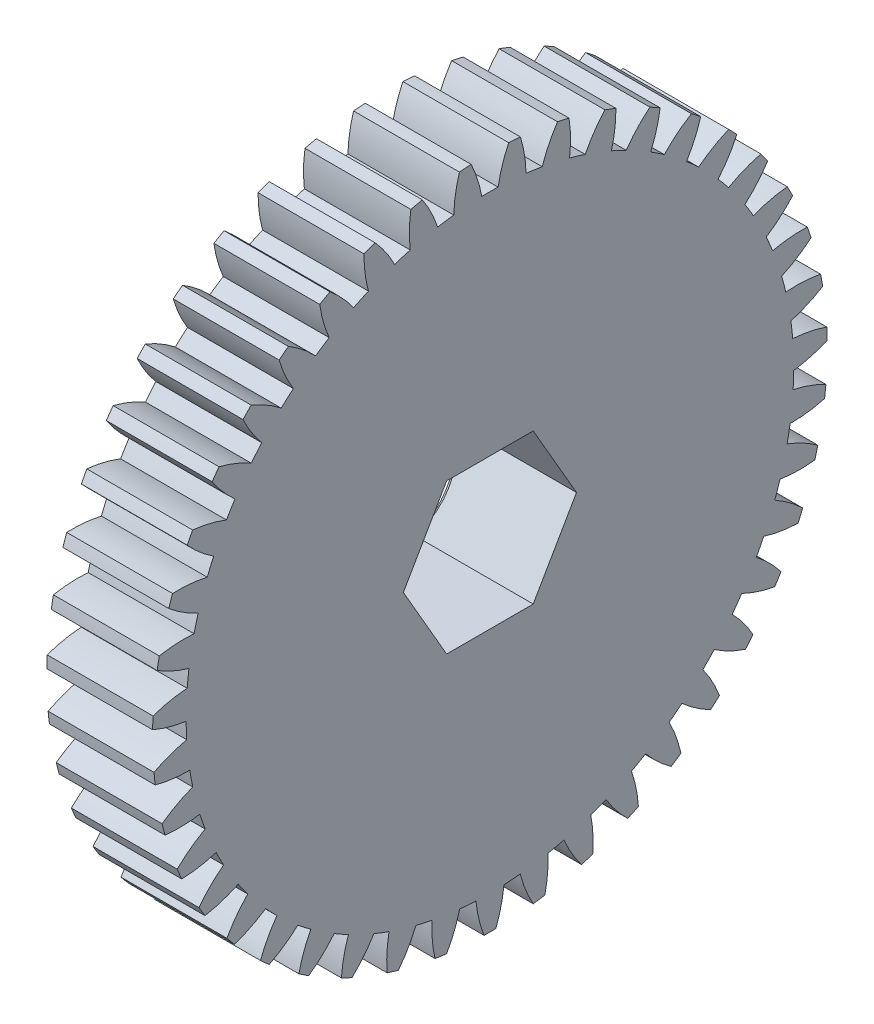
from build123d import *

# Parameters (mm, degrees)
BOSS_EXTRUDE1_START     = -0.508
BOSS_EXTRUDE1_OUTLINE_R = 28.575
BOSS_EXTRUDE1_DEPTH     = 9.474200466
CUT_EXTRUDE1_DEPTH      = 42.506887675
CUT_EXTRUDE2_DEPTH      = 42.506887675
CUT_EXTRUDE3_DEPTH      = 42.506887675
CUT_EXTRUDE4_DEPTH      = 42.506887675
CUT_EXTRUDE5_DEPTH      = 42.506887675
CUT_EXTRUDE6_DEPTH      = 42.506887675
CUT_EXTRUDE7_DEPTH      = 42.506887675
CUT_EXTRUDE8_DEPTH      = 42.506887675
CUT_EXTRUDE9_DEPTH      = 42.506887675
CUT_EXTRUDE10_DEPTH     = 42.506887675
CUT_EXTRUDE11_DEPTH     = 42.506887675
CUT_EXTRUDE12_DEPTH     = 42.506887675
CUT_EXTRUDE13_DEPTH     = 42.506887675
CUT_EXTRUDE14_DEPTH     = 42.506887675
CUT_EXTRUDE15_DEPTH     = 42.506887675
CUT_EXTRUDE16_DEPTH     = 42.506887675
CUT_EXTRUDE17_DEPTH     = 42.506887675
CUT_EXTRUDE18_DEPTH     = 42.506887675
CUT_EXTRUDE19_DEPTH     = 42.506887675
CUT_EXTRUDE20_DEPTH     = 42.506887675
CUT_EXTRUDE21_DEPTH     = 42.506887675
CUT_EXTRUDE22_DEPTH     = 42.506887675
CUT_EXTRUDE23_DEPTH     = 42.506887675
CUT_EXTRUDE24_DEPTH     = 42.506887675
CUT_EXTRUDE25_DEPTH     = 42.506887675
CUT_EXTRUDE26_DEPTH     = 42.506887675
CUT_EXTRUDE27_DEPTH     = 42.506887675
CUT_EXTRUDE28_DEPTH     = 42.506887675
CUT_EXTRUDE29_DEPTH     = 42.506887675
CUT_EXTRUDE30_DEPTH     = 42.506887675
CUT_EXTRUDE31_DEPTH     = 42.506887675
CUT_EXTRUDE32_DEPTH     = 42.503291927
CUT_EXTRUDE33_DEPTH     = 42.503291927
CUT_EXTRUDE34_DEPTH     = 42.503291927
CUT_EXTRUDE35_DEPTH     = 42.503291927
CUT_EXTRUDE36_DEPTH     = 42.503291927
CUT_EXTRUDE37_DEPTH     = 42.503291927
CUT_EXTRUDE38_DEPTH     = 42.503291927
CUT_EXTRUDE39_DEPTH     = 42.503291927
CUT_EXTRUDE40_DEPTH     = 42.503291927
CUT_EXTRUDE41_DEPTH     = 42.503291927
CUT_EXTRUDE42_DEPTH     = 42.503291927
CUT_EXTRUDE43_DEPTH     = 42.503291927


with BuildPart() as part:
    # Boss-Extrude1: read off the stored shape, not the designer's step
    # Boss-Extrude1 outline → Boss-Extrude1 (new body)
    with BuildSketch(Plane(origin=(0, 0, 0), x_dir=(0, 0, -1), z_dir=(1, 0, 0)).offset(BOSS_EXTRUDE1_START)):
        Circle(BOSS_EXTRUDE1_OUTLINE_R)
        Polygon((-3.666174209, 6.35), (3.666174209, 6.35), (7.332348419, 0), (3.666174209, -6.35), (-3.666174209, -6.35), (-7.332348419, 0), align=None, mode=Mode.SUBTRACT)
    extrude(amount=BOSS_EXTRUDE1_DEPTH)

    # Boss-Extrude1 2 outline → Boss-Extrude1 2 (revolve, cut)
    with BuildSketch(Plane.YX):
        Polygon((9.525, 0), (9.017, -0.508), (28.575, -0.508), (28.575, 0), align=None)
        Polygon((6.35, -0.508), (6.858, -0.508), (6.35, 0), align=None)
    revolve(axis=Axis((0, 0, 0), (1, 0, 0)), mode=Mode.SUBTRACT)

    # Sketch2 → Cut-Extrude1 (cut, through all)
    with BuildSketch(Plane(origin=(8.966200466, 0, 0), x_dir=(0, 0, -1), z_dir=(1, 0, 0))):
        with BuildLine():
            ThreePointArc((9.741695801, 26.863171591), (8.232431764, 27.363437142), (6.697678458, 27.778979972))
            ThreePointArc((6.697678458, 27.778979972), (6.823390693, 26.305881), (6.749002824, 24.82930029))
            ThreePointArc((6.749002824, 24.82930029), (7.412847446, 24.639254956), (8.071353298, 24.431464303))
            ThreePointArc((8.071353298, 24.431464303), (8.82404358, 25.703974219), (9.741695801, 26.863171591))
        make_face()
    extrude(amount=-CUT_EXTRUDE1_DEPTH, mode=Mode.SUBTRACT)

    # Sketch3 → Cut-Extrude2 (cut, through all)
    with BuildSketch(Plane(origin=(8.966200466, 0, 0), x_dir=(0, 0, -1), z_dir=(1, 0, 0))):
        with BuildLine():
            ThreePointArc((13.549191287, 25.158498375), (12.12885017, 25.873183386), (10.670955687, 26.507759802))
            ThreePointArc((10.670955687, 26.507759802), (10.580843322, 25.032055256), (10.292256302, 23.582040884))
            ThreePointArc((10.292256302, 23.582040884), (10.921355753, 23.29736424), (11.542589588, 22.995908715))
            ThreePointArc((11.542589588, 22.995908715), (12.472537657, 24.145265377), (13.549191287, 25.158498375))
        make_face()
    extrude(amount=-CUT_EXTRUDE2_DEPTH, mode=Mode.SUBTRACT)

    # Sketch4 → Cut-Extrude3 (cut, through all)
    with BuildSketch(Plane(origin=(8.966200466, 0, 0), x_dir=(0, 0, -1), z_dir=(1, 0, 0))):
        with BuildLine():
            ThreePointArc((17.067909284, 22.917615445), (15.766763193, 23.831487646), (14.416800021, 24.671572754))
            ThreePointArc((14.416800021, 24.671572754), (14.112783645, 23.224714713), (13.616148205, 21.832171218))
            ThreePointArc((13.616148205, 21.832171218), (14.197094324, 21.458930654), (14.767815622, 21.070235257))
            ThreePointArc((14.767815622, 21.070235257), (15.855201248, 22.071942124), (17.067909284, 22.917615445))
        make_face()
    extrude(amount=-CUT_EXTRUDE3_DEPTH, mode=Mode.SUBTRACT)

    # Sketch5 → Cut-Extrude4 (cut, through all)
    with BuildSketch(Plane(origin=(8.966200466, 0, 0), x_dir=(0, 0, -1), z_dir=(1, 0, 0))):
        with BuildLine():
            ThreePointArc((20.222854428, 20.18828333), (19.068635031, 21.281865122), (17.855375292, 22.309553966))
            ThreePointArc((17.855375292, 22.309553966), (17.343934487, 20.922379698), (16.649835549, 19.616986727))
            ThreePointArc((16.649835549, 19.616986727), (17.170246477, 19.163137216), (17.678291304, 18.695486316))
            ThreePointArc((17.678291304, 18.695486316), (18.899938752, 19.528193745), (20.222854428, 20.18828333))
        make_face()
    extrude(amount=-CUT_EXTRUDE4_DEPTH, mode=Mode.SUBTRACT)

    # Sketch6 → Cut-Extrude5 (cut, through all)
    with BuildSketch(Plane(origin=(8.966200466, 0, 0), x_dir=(0, 0, -1), z_dir=(1, 0, 0))):
        with BuildLine():
            ThreePointArc((22.946784539, 17.028673005), (21.964092019, 18.278656591), (20.913394239, 19.472045768))
            ThreePointArc((20.913394239, 19.472045768), (20.205429477, 18.174120484), (19.328660555, 16.983700221))
            ThreePointArc((19.328660555, 16.983700221), (19.777444636, 16.458914779), (20.2119849, 15.922275542))
            ThreePointArc((20.2119849, 15.922275542), (21.541856874, 16.568235819), (22.946784539, 17.028673005))
        make_face()
    extrude(amount=-CUT_EXTRUDE5_DEPTH, mode=Mode.SUBTRACT)

    # Sketch7 → Cut-Extrude6 (cut, through all)
    with BuildSketch(Plane(origin=(8.966200466, 0, 0), x_dir=(0, 0, -1), z_dir=(1, 0, 0))):
        with BuildLine():
            ThreePointArc((25.181643777, 13.50612608), (24.391422519, 14.885870229), (23.525680496, 16.219524721))
            ThreePointArc((23.525680496, 16.219524721), (22.636280817, 15.038511445), (21.595528718, 13.988435632))
            ThreePointArc((21.595528718, 13.988435632), (21.9631209, 13.403899149), (22.314895128, 12.809709109))
            ThreePointArc((22.314895128, 12.809709109), (23.724647717, 13.255154713), (25.181643777, 13.50612608))
        make_face()
    extrude(amount=-CUT_EXTRUDE6_DEPTH, mode=Mode.SUBTRACT)

    # Sketch8 → Cut-Extrude7 (cut, through all)
    with BuildSketch(Plane(origin=(8.966200466, 0, 0), x_dir=(0, 0, -1), z_dir=(1, 0, 0))):
        with BuildLine():
            ThreePointArc((26.879799997, 9.695719527), (26.298892195, 11.175817388), (25.636557718, 12.621312664))
            ThreePointArc((25.636557718, 12.621312664), (24.584679132, 11.582382644), (23.40212568, 10.695031823))
            ThreePointArc((23.40212568, 10.695031823), (23.680691372, 10.063202679), (23.942202109, 9.424125965))
            ThreePointArc((23.942202109, 9.424125965), (25.401788883, 9.659562996), (26.879799997, 9.695719527))
        make_face()
    extrude(amount=-CUT_EXTRUDE7_DEPTH, mode=Mode.SUBTRACT)

    # Sketch9 → Cut-Extrude8 (cut, through all)
    with BuildSketch(Plane(origin=(8.966200466, 0, 0), x_dir=(0, 0, -1), z_dir=(1, 0, 0))):
        with BuildLine():
            ThreePointArc((28.005059947, 5.678665544), (27.645846643, 7.227571402), (27.201036221, 8.75409924))
            ThreePointArc((27.201036221, 8.75409924), (26.009097694, 7.879395465), (24.709946963, 7.173681979))
            ThreePointArc((24.709946963, 7.173681979), (24.893549022, 6.508026516), (25.059222619, 5.837683939))
            ThreePointArc((25.059222619, 5.837683939), (26.537535021, 5.858094465), (28.005059947, 5.678665544))
        make_face()
    extrude(amount=-CUT_EXTRUDE8_DEPTH, mode=Mode.SUBTRACT)

    # Sketch10 → Cut-Extrude9 (cut, through all)
    with BuildSketch(Plane(origin=(8.966200466, 0, 0), x_dir=(0, 0, -1), z_dir=(1, 0, 0))):
        with BuildLine():
            ThreePointArc((28.533440666, 1.540580665), (28.403577867, 3.125282279), (28.185771862, 4.700307389))
            ThreePointArc((28.185771862, 4.700307389), (26.879177494, 4.008472652), (25.491118626, 3.499437558))
            ThreePointArc((25.491118626, 3.499437558), (25.575843893, 2.814143066), (25.642149306, 2.126821814))
            ThreePointArc((25.642149306, 2.126821814), (27.107679673, 1.93177082), (28.533440666, 1.540580665))
        make_face()
    extrude(amount=-CUT_EXTRUDE9_DEPTH, mode=Mode.SUBTRACT)

    # Sketch11 → Cut-Extrude10 (cut, through all)
    with BuildSketch(Plane(origin=(8.966200466, 0, 0), x_dir=(0, 0, -1), z_dir=(1, 0, 0))):
        with BuildLine():
            ThreePointArc((28.453680635, -2.630339017), (28.555936142, -1.043616809), (28.56977671, 0.546336647))
            ThreePointArc((28.56977671, 0.546336647), (27.176374292, 0.052116204), (25.728991353, -0.249391299))
            ThreePointArc((25.728991353, -0.249391299), (25.713034055, -0.939718958), (25.678558098, -1.629369826))
            ThreePointArc((25.678558098, -1.629369826), (27.100071195, -2.035725165), (28.453680635, -2.630339017))
        make_face()
    extrude(amount=-CUT_EXTRUDE10_DEPTH, mode=Mode.SUBTRACT)

    # Sketch12 → Cut-Extrude11 (cut, through all)
    with BuildSketch(Plane(origin=(8.966200466, 0, 0), x_dir=(0, 0, -1), z_dir=(1, 0, 0))):
        with BuildLine():
            ThreePointArc((27.767479801, -6.745197589), (28.099674215, -5.190273017), (28.344866369, -3.619278313))
            ThreePointArc((28.344866369, -3.619278313), (26.894353854, -3.905351011), (25.418495298, -3.992904813))
            ThreePointArc((25.418495298, -3.992904813), (25.302195538, -4.673552503), (25.167673007, -5.350834276))
            ThreePointArc((25.167673007, -5.350834276), (26.51487175, -5.959833203), (27.767479801, -6.745197589))
        make_face()
    extrude(amount=-CUT_EXTRUDE11_DEPTH, mode=Mode.SUBTRACT)

    # Sketch13 → Cut-Extrude12 (cut, through all)
    with BuildSketch(Plane(origin=(8.966200466, 0, 0), x_dir=(0, 0, -1), z_dir=(1, 0, 0))):
        with BuildLine():
            ThreePointArc((26.489463344, -10.716293985), (27.044516518, -9.226307566), (27.515834413, -7.707754638))
            ThreePointArc((27.515834413, -7.707754638), (26.039126956, -7.779582449), (24.566248146, -7.651316494))
            ThreePointArc((24.566248146, -7.651316494), (24.352084651, -8.307777391), (24.12038266, -8.958254984))
            ThreePointArc((24.12038266, -8.958254984), (25.364553847, -9.756917744), (26.489463344, -10.716293985))
        make_face()
    extrude(amount=-CUT_EXTRUDE12_DEPTH, mode=Mode.SUBTRACT)

    # Sketch14 → Cut-Extrude13 (cut, through all)
    with BuildSketch(Plane(origin=(8.966200466, 0, 0), x_dir=(0, 0, -1), z_dir=(1, 0, 0))):
        with BuildLine():
            ThreePointArc((24.646869965, -14.45899118), (25.412951904, -13.065699388), (26.100350217, -11.631953556))
            ThreePointArc((26.100350217, -11.631953556), (24.628921276, -11.488005594), (23.190414065, -11.146653647))
            ThreePointArc((23.190414065, -11.146653647), (22.882951359, -11.764936427), (22.559008234, -12.374746039))
            ThreePointArc((22.559008234, -12.374746039), (23.673634516, -13.346050522), (24.646869965, -14.45899118))
        make_face()
    extrude(amount=-CUT_EXTRUDE13_DEPTH, mode=Mode.SUBTRACT)

    # Sketch15 → Cut-Extrude14 (cut, through all)
    with BuildSketch(Plane(origin=(8.966200466, 0, 0), x_dir=(0, 0, -1), z_dir=(1, 0, 0))):
        with BuildLine():
            ThreePointArc((22.278971344, -17.89352008), (23.239754342, -16.626618512), (24.128582371, -15.308237578))
            ThreePointArc((24.128582371, -15.308237578), (22.693792897, -14.951581845), (21.320316571, -14.40441923))
            ThreePointArc((21.320316571, -14.40441923), (20.926107687, -14.971346269), (20.516827713, -15.527490867))
            ThreePointArc((20.516827713, -15.527490867), (21.478152766, -16.650735404), (22.278971344, -17.89352008))
        make_face()
    extrude(amount=-CUT_EXTRUDE14_DEPTH, mode=Mode.SUBTRACT)

    # Sketch16 → Cut-Extrude15 (cut, through all)
    with BuildSketch(Plane(origin=(8.966200466, 0, 0), x_dir=(0, 0, -1), z_dir=(1, 0, 0))):
        with BuildLine():
            ThreePointArc((19.436235128, -20.946679667), (20.571241763, -19.833170128), (21.642555683, -18.658253094))
            ThreePointArc((21.642555683, -18.658253094), (20.274985723, -18.096491087), (18.995813544, -17.355179626))
            ThreePointArc((18.995813544, -17.355179626), (18.52326036, -17.858667858), (18.037366629, -18.349294186))
            ThreePointArc((18.037366629, -18.349294186), (18.824901479, -19.600538769), (19.436235128, -20.946679667))
        make_face()
    extrude(amount=-CUT_EXTRUDE15_DEPTH, mode=Mode.SUBTRACT)

    # Sketch17 → Cut-Extrude16 (cut, through all)
    with BuildSketch(Plane(origin=(8.966200466, 0, 0), x_dir=(0, 0, -1), z_dir=(1, 0, 0))):
        with BuildLine():
            ThreePointArc((16.179249304, -23.553397142), (17.46428888, -22.617012157), (18.695255495, -21.610600339))
            ThreePointArc((18.695255495, -21.610600339), (17.424052429, -20.855705039), (16.266447731, -19.936044498))
            ThreePointArc((16.266447731, -19.936044498), (15.725621898, -20.365362947), (15.173470392, -20.780014156))
            ThreePointArc((15.173470392, -20.780014156), (15.7704301, -22.13259068), (16.179249304, -23.553397142))
        make_face()
    extrude(amount=-CUT_EXTRUDE16_DEPTH, mode=Mode.SUBTRACT)

    # Sketch18 → Cut-Extrude17 (cut, through all)
    with BuildSketch(Plane(origin=(8.966200466, 0, 0), x_dir=(0, 0, -1), z_dir=(1, 0, 0))):
        with BuildLine():
            ThreePointArc((12.577430872, -25.65811485), (13.985115001, -24.918811838), (15.349498393, -24.102355156))
            ThreePointArc((15.349498393, -24.102355156), (14.201755708, -23.170415848), (13.190390826, -22.092007195))
            ThreePointArc((13.190390826, -22.092007195), (12.592819108, -22.438005681), (11.986177976, -22.767844201))
            ThreePointArc((11.986177976, -22.767844201), (12.379839383, -24.192924845), (12.577430872, -25.65811485))
        make_face()
    extrude(amount=-CUT_EXTRUDE17_DEPTH, mode=Mode.SUBTRACT)

    # Sketch19 → Cut-Extrude18 (cut, through all)
    with BuildSketch(Plane(origin=(8.966200466, 0, 0), x_dir=(0, 0, -1), z_dir=(1, 0, 0))):
        with BuildLine():
            ThreePointArc((8.707546336, -27.215974386), (10.207872676, -26.689510307), (11.676593383, -26.080410119))
            ThreePointArc((11.676593383, -26.080410119), (10.67677322, -24.991289469), (9.833203641, -23.777117113))
            ThreePointArc((9.833203641, -23.777117113), (9.191622241, -24.032421281), (8.543420987, -24.270417176))
            ThreePointArc((8.543420987, -24.270417176), (8.725393883, -25.737628821), (8.707546336, -27.215974386))
        make_face()
    extrude(amount=-CUT_EXTRUDE18_DEPTH, mode=Mode.SUBTRACT)

    # Sketch20 → Cut-Extrude19 (cut, through all)
    with BuildSketch(Plane(origin=(8.966200466, 0, 0), x_dir=(0, 0, -1), z_dir=(1, 0, 0))):
        with BuildLine():
            ThreePointArc((4.652075568, -28.19377268), (6.213067267, -27.891368201), (7.754822057, -27.50260642))
            ThreePointArc((7.754822057, -27.50260642), (6.924233848, -26.279517145), (6.266438792, -24.95545906))
            ThreePointArc((6.266438792, -24.95545906), (5.594521904, -25.114627545), (4.918575812, -25.255708345))
            ThreePointArc((4.918575812, -25.255708345), (4.884981761, -26.733779922), (4.652075568, -28.19377268))
        make_face()
    extrude(amount=-CUT_EXTRUDE19_DEPTH, mode=Mode.SUBTRACT)

    # Sketch21 → Cut-Extrude20 (cut, through all)
    with BuildSketch(Plane(origin=(8.966200466, 0, 0), x_dir=(0, 0, -1), z_dir=(1, 0, 0))):
        with BuildLine():
            ThreePointArc((0.497453886, -28.570669657), (2.085841116, -28.498770006), (3.667770162, -28.338632413))
            ThreePointArc((3.667770162, -28.338632413), (3.024116453, -27.007642537), (2.56611568, -25.601918724))
            ThreePointArc((2.56611568, -25.601918724), (1.878184045, -25.661559125), (1.188899733, -25.702717939))
            ThreePointArc((1.188899733, -25.702717939), (0.940454734, -27.160146918), (0.497453886, -28.570669657))
        make_face()
    extrude(amount=-CUT_EXTRUDE20_DEPTH, mode=Mode.SUBTRACT)

    # Sketch22 → Cut-Extrude21 (cut, through all)
    with BuildSketch(Plane(origin=(8.966200466, 0, 0), x_dir=(0, 0, -1), z_dir=(1, 0, 0))):
        with BuildLine():
            ThreePointArc((-3.667770162, -28.338632413), (-2.085841116, -28.498770006), (-0.497453886, -28.570669657))
            ThreePointArc((-0.497453886, -28.570669657), (-0.940454734, -27.160146918), (-1.188899733, -25.702717939))
            ThreePointArc((-1.188899733, -25.702717939), (-1.878184045, -25.661559125), (-2.56611568, -25.601918724))
            ThreePointArc((-2.56611568, -25.601918724), (-3.024116453, -27.007642537), (-3.667770162, -28.338632413))
        make_face()
    extrude(amount=-CUT_EXTRUDE21_DEPTH, mode=Mode.SUBTRACT)

    # Sketch23 → Cut-Extrude22 (cut, through all)
    with BuildSketch(Plane(origin=(8.966200466, 0, 0), x_dir=(0, 0, -1), z_dir=(1, 0, 0))):
        with BuildLine():
            ThreePointArc((-7.754822057, -27.50260642), (-6.213067267, -27.891368201), (-4.652075568, -28.19377268))
            ThreePointArc((-4.652075568, -28.19377268), (-4.884981761, -26.733779922), (-4.918575812, -25.255708345))
            ThreePointArc((-4.918575812, -25.255708345), (-5.594521904, -25.114627545), (-6.266438792, -24.95545906))
            ThreePointArc((-6.266438792, -24.95545906), (-6.924233848, -26.279517145), (-7.754822057, -27.50260642))
        make_face()
    extrude(amount=-CUT_EXTRUDE22_DEPTH, mode=Mode.SUBTRACT)

    # Sketch24 → Cut-Extrude23 (cut, through all)
    with BuildSketch(Plane(origin=(8.966200466, 0, 0), x_dir=(0, 0, -1), z_dir=(1, 0, 0))):
        with BuildLine():
            ThreePointArc((-11.676593383, -26.080410119), (-10.207872676, -26.689510307), (-8.707546336, -27.215974386))
            ThreePointArc((-8.707546336, -27.215974386), (-8.725393883, -25.737628821), (-8.543420987, -24.270417176))
            ThreePointArc((-8.543420987, -24.270417176), (-9.191622241, -24.032421281), (-9.833203641, -23.777117113))
            ThreePointArc((-9.833203641, -23.777117113), (-10.67677322, -24.991289469), (-11.676593383, -26.080410119))
        make_face()
    extrude(amount=-CUT_EXTRUDE23_DEPTH, mode=Mode.SUBTRACT)

    # Sketch25 → Cut-Extrude24 (cut, through all)
    with BuildSketch(Plane(origin=(8.966200466, 0, 0), x_dir=(0, 0, -1), z_dir=(1, 0, 0))):
        with BuildLine():
            ThreePointArc((-15.349498393, -24.102355156), (-13.985115001, -24.918811838), (-12.577430872, -25.65811485))
            ThreePointArc((-12.577430872, -25.65811485), (-12.379839383, -24.192924845), (-11.986177976, -22.767844201))
            ThreePointArc((-11.986177976, -22.767844201), (-12.592819108, -22.438005681), (-13.190390826, -22.092007195))
            ThreePointArc((-13.190390826, -22.092007195), (-14.201755708, -23.170415848), (-15.349498393, -24.102355156))
        make_face()
    extrude(amount=-CUT_EXTRUDE24_DEPTH, mode=Mode.SUBTRACT)

    # Sketch26 → Cut-Extrude25 (cut, through all)
    with BuildSketch(Plane(origin=(8.966200466, 0, 0), x_dir=(0, 0, -1), z_dir=(1, 0, 0))):
        with BuildLine():
            ThreePointArc((-18.695255495, -21.610600339), (-17.46428888, -22.617012157), (-16.179249304, -23.553397142))
            ThreePointArc((-16.179249304, -23.553397142), (-15.7704301, -22.13259068), (-15.173470392, -20.780014156))
            ThreePointArc((-15.173470392, -20.780014156), (-15.725621898, -20.365362947), (-16.266447731, -19.936044498))
            ThreePointArc((-16.266447731, -19.936044498), (-17.424052429, -20.855705039), (-18.695255495, -21.610600339))
        make_face()
    extrude(amount=-CUT_EXTRUDE25_DEPTH, mode=Mode.SUBTRACT)

    # Sketch27 → Cut-Extrude26 (cut, through all)
    with BuildSketch(Plane(origin=(8.966200466, 0, 0), x_dir=(0, 0, -1), z_dir=(1, 0, 0))):
        with BuildLine():
            ThreePointArc((-21.642555683, -18.658253094), (-20.571241763, -19.833170128), (-19.436235128, -20.946679667))
            ThreePointArc((-19.436235128, -20.946679667), (-18.824901479, -19.600538769), (-18.037366629, -18.349294186))
            ThreePointArc((-18.037366629, -18.349294186), (-18.52326036, -17.858667858), (-18.995813544, -17.355179626))
            ThreePointArc((-18.995813544, -17.355179626), (-20.274985723, -18.096491087), (-21.642555683, -18.658253094))
        make_face()
    extrude(amount=-CUT_EXTRUDE26_DEPTH, mode=Mode.SUBTRACT)

    # Sketch28 → Cut-Extrude27 (cut, through all)
    with BuildSketch(Plane(origin=(8.966200466, 0, 0), x_dir=(0, 0, -1), z_dir=(1, 0, 0))):
        with BuildLine():
            ThreePointArc((-24.128582371, -15.308237578), (-23.239754342, -16.626618512), (-22.278971344, -17.89352008))
            ThreePointArc((-22.278971344, -17.89352008), (-21.478152766, -16.650735404), (-20.516827713, -15.527490867))
            ThreePointArc((-20.516827713, -15.527490867), (-20.926107687, -14.971346269), (-21.320316571, -14.40441923))
            ThreePointArc((-21.320316571, -14.40441923), (-22.693792897, -14.951581845), (-24.128582371, -15.308237578))
        make_face()
    extrude(amount=-CUT_EXTRUDE27_DEPTH, mode=Mode.SUBTRACT)

    # Sketch29 → Cut-Extrude28 (cut, through all)
    with BuildSketch(Plane(origin=(8.966200466, 0, 0), x_dir=(0, 0, -1), z_dir=(1, 0, 0))):
        with BuildLine():
            ThreePointArc((-26.100350217, -11.631953556), (-25.412951904, -13.065699388), (-24.646869965, -14.45899118))
            ThreePointArc((-24.646869965, -14.45899118), (-23.673634516, -13.346050522), (-22.559008234, -12.374746039))
            ThreePointArc((-22.559008234, -12.374746039), (-22.882951359, -11.764936427), (-23.190414065, -11.146653647))
            ThreePointArc((-23.190414065, -11.146653647), (-24.628921276, -11.488005594), (-26.100350217, -11.631953556))
        make_face()
    extrude(amount=-CUT_EXTRUDE28_DEPTH, mode=Mode.SUBTRACT)

    # Sketch30 → Cut-Extrude29 (cut, through all)
    with BuildSketch(Plane(origin=(8.966200466, 0, 0), x_dir=(0, 0, -1), z_dir=(1, 0, 0))):
        with BuildLine():
            ThreePointArc((-27.515834413, -7.707754638), (-27.044516518, -9.226307566), (-26.489463344, -10.716293985))
            ThreePointArc((-26.489463344, -10.716293985), (-25.364553847, -9.756917744), (-24.12038266, -8.958254984))
            ThreePointArc((-24.12038266, -8.958254984), (-24.352084651, -8.307777391), (-24.566248146, -7.651316494))
            ThreePointArc((-24.566248146, -7.651316494), (-26.039126956, -7.779582449), (-27.515834413, -7.707754638))
        make_face()
    extrude(amount=-CUT_EXTRUDE29_DEPTH, mode=Mode.SUBTRACT)

    # Sketch31 → Cut-Extrude30 (cut, through all)
    with BuildSketch(Plane(origin=(8.966200466, 0, 0), x_dir=(0, 0, -1), z_dir=(1, 0, 0))):
        with BuildLine():
            ThreePointArc((-28.344866369, -3.619278313), (-28.099674215, -5.190273017), (-27.767479801, -6.745197589))
            ThreePointArc((-27.767479801, -6.745197589), (-26.51487175, -5.959833203), (-25.167673007, -5.350834276))
            ThreePointArc((-25.167673007, -5.350834276), (-25.302195538, -4.673552503), (-25.418495298, -3.992904813))
            ThreePointArc((-25.418495298, -3.992904813), (-26.894353854, -3.905351011), (-28.344866369, -3.619278313))
        make_face()
    extrude(amount=-CUT_EXTRUDE30_DEPTH, mode=Mode.SUBTRACT)

    # Sketch32 → Cut-Extrude31 (cut, through all)
    with BuildSketch(Plane(origin=(8.966200466, 0, 0), x_dir=(0, 0, -1), z_dir=(1, 0, 0))):
        with BuildLine():
            ThreePointArc((-28.56977671, 0.546336647), (-28.555936142, -1.043616809), (-28.453680635, -2.630339017))
            ThreePointArc((-28.453680635, -2.630339017), (-27.100071195, -2.035725165), (-25.678558098, -1.629369826))
            ThreePointArc((-25.678558098, -1.629369826), (-25.713034055, -0.939718958), (-25.728991353, -0.249391299))
            ThreePointArc((-25.728991353, -0.249391299), (-27.176374292, 0.052116204), (-28.56977671, 0.546336647))
        make_face()
    extrude(amount=-CUT_EXTRUDE31_DEPTH, mode=Mode.SUBTRACT)

    # Sketch33 → Cut-Extrude32 (cut, through all)
    with BuildSketch(Plane(origin=(8.966200466, 0, 0), x_dir=(0, 0, -1), z_dir=(1, 0, 0))):
        with BuildLine():
            ThreePointArc((-28.185771862, 4.700307389), (-28.403577867, 3.125282279), (-28.533440666, 1.540580665))
            ThreePointArc((-28.533440666, 1.540580665), (-27.107679673, 1.93177082), (-25.642149306, 2.126821814))
            ThreePointArc((-25.642149306, 2.126821814), (-25.575843893, 2.814143066), (-25.491118626, 3.499437558))
            ThreePointArc((-25.491118626, 3.499437558), (-26.879177494, 4.008472652), (-28.185771862, 4.700307389))
        make_face()
    extrude(amount=-CUT_EXTRUDE32_DEPTH, mode=Mode.SUBTRACT)

    # Sketch34 → Cut-Extrude33 (cut, through all)
    with BuildSketch(Plane(origin=(8.966200466, 0, 0), x_dir=(0, 0, -1), z_dir=(1, 0, 0))):
        with BuildLine():
            ThreePointArc((-27.201036221, 8.75409924), (-27.645846643, 7.227571402), (-28.005059947, 5.678665544))
            ThreePointArc((-28.005059947, 5.678665544), (-26.537535021, 5.858094465), (-25.059222619, 5.837683939))
            ThreePointArc((-25.059222619, 5.837683939), (-24.893549022, 6.508026516), (-24.709946963, 7.173681979))
            ThreePointArc((-24.709946963, 7.173681979), (-26.009097694, 7.879395465), (-27.201036221, 8.75409924))
        make_face()
    extrude(amount=-CUT_EXTRUDE33_DEPTH, mode=Mode.SUBTRACT)

    # Sketch35 → Cut-Extrude34 (cut, through all)
    with BuildSketch(Plane(origin=(8.966200466, 0, 0), x_dir=(0, 0, -1), z_dir=(1, 0, 0))):
        with BuildLine():
            ThreePointArc((-25.636557718, 12.621312664), (-26.298892195, 11.175817388), (-26.879799997, 9.695719527))
            ThreePointArc((-26.879799997, 9.695719527), (-25.401788883, 9.659562996), (-23.942202109, 9.424125965))
            ThreePointArc((-23.942202109, 9.424125965), (-23.680691372, 10.063202679), (-23.40212568, 10.695031823))
            ThreePointArc((-23.40212568, 10.695031823), (-24.584679132, 11.582382644), (-25.636557718, 12.621312664))
        make_face()
    extrude(amount=-CUT_EXTRUDE34_DEPTH, mode=Mode.SUBTRACT)

    # Sketch36 → Cut-Extrude35 (cut, through all)
    with BuildSketch(Plane(origin=(8.966200466, 0, 0), x_dir=(0, 0, -1), z_dir=(1, 0, 0))):
        with BuildLine():
            ThreePointArc((-23.525680496, 16.219524721), (-24.391422519, 14.885870229), (-25.181643777, 13.50612608))
            ThreePointArc((-25.181643777, 13.50612608), (-23.724647717, 13.255154713), (-22.314895128, 12.809709109))
            ThreePointArc((-22.314895128, 12.809709109), (-21.9631209, 13.403899149), (-21.595528718, 13.988435632))
            ThreePointArc((-21.595528718, 13.988435632), (-22.636280817, 15.038511445), (-23.525680496, 16.219524721))
        make_face()
    extrude(amount=-CUT_EXTRUDE35_DEPTH, mode=Mode.SUBTRACT)

    # Sketch37 → Cut-Extrude36 (cut, through all)
    with BuildSketch(Plane(origin=(8.966200466, 0, 0), x_dir=(0, 0, -1), z_dir=(1, 0, 0))):
        with BuildLine():
            ThreePointArc((-20.913394239, 19.472045768), (-21.964092019, 18.278656591), (-22.946784539, 17.028673005))
            ThreePointArc((-22.946784539, 17.028673005), (-21.541856874, 16.568235819), (-20.2119849, 15.922275542))
            ThreePointArc((-20.2119849, 15.922275542), (-19.777444636, 16.458914779), (-19.328660555, 16.983700221))
            ThreePointArc((-19.328660555, 16.983700221), (-20.205429477, 18.174120484), (-20.913394239, 19.472045768))
        make_face()
    extrude(amount=-CUT_EXTRUDE36_DEPTH, mode=Mode.SUBTRACT)

    # Sketch38 → Cut-Extrude37 (cut, through all)
    with BuildSketch(Plane(origin=(8.966200466, 0, 0), x_dir=(0, 0, -1), z_dir=(1, 0, 0))):
        with BuildLine():
            ThreePointArc((-17.855375292, 22.309553966), (-19.068635031, 21.281865122), (-20.222854428, 20.18828333))
            ThreePointArc((-20.222854428, 20.18828333), (-18.899938752, 19.528193745), (-17.678291304, 18.695486316))
            ThreePointArc((-17.678291304, 18.695486316), (-17.170246477, 19.163137216), (-16.649835549, 19.616986727))
            ThreePointArc((-16.649835549, 19.616986727), (-17.343934487, 20.922379698), (-17.855375292, 22.309553966))
        make_face()
    extrude(amount=-CUT_EXTRUDE37_DEPTH, mode=Mode.SUBTRACT)

    # Sketch39 → Cut-Extrude38 (cut, through all)
    with BuildSketch(Plane(origin=(8.966200466, 0, 0), x_dir=(0, 0, -1), z_dir=(1, 0, 0))):
        with BuildLine():
            ThreePointArc((-14.416800021, 24.671572754), (-15.766763193, 23.831487646), (-17.067909284, 22.917615445))
            ThreePointArc((-17.067909284, 22.917615445), (-15.855201248, 22.071942124), (-14.767815622, 21.070235257))
            ThreePointArc((-14.767815622, 21.070235257), (-14.197094324, 21.458930654), (-13.616148205, 21.832171218))
            ThreePointArc((-13.616148205, 21.832171218), (-14.112783645, 23.224714713), (-14.416800021, 24.671572754))
        make_face()
    extrude(amount=-CUT_EXTRUDE38_DEPTH, mode=Mode.SUBTRACT)

    # Sketch40 → Cut-Extrude39 (cut, through all)
    with BuildSketch(Plane(origin=(8.966200466, 0, 0), x_dir=(0, 0, -1), z_dir=(1, 0, 0))):
        with BuildLine():
            ThreePointArc((-13.549191287, 25.158498375), (-12.472537657, 24.145265377), (-11.542589588, 22.995908715))
            ThreePointArc((-11.542589588, 22.995908715), (-10.921355753, 23.29736424), (-10.292256302, 23.582040884))
            ThreePointArc((-10.292256302, 23.582040884), (-10.580843322, 25.032055256), (-10.670955687, 26.507759802))
            ThreePointArc((-10.670955687, 26.507759802), (-12.12885017, 25.873183386), (-13.549191287, 25.158498375))
        make_face()
    extrude(amount=-CUT_EXTRUDE39_DEPTH, mode=Mode.SUBTRACT)

    # Sketch41 → Cut-Extrude40 (cut, through all)
    with BuildSketch(Plane(origin=(8.966200466, 0, 0), x_dir=(0, 0, -1), z_dir=(1, 0, 0))):
        with BuildLine():
            ThreePointArc((-6.697678458, 27.778979972), (-8.232431764, 27.363437142), (-9.741695801, 26.863171591))
            ThreePointArc((-9.741695801, 26.863171591), (-8.82404358, 25.703974219), (-8.071353298, 24.431464303))
            ThreePointArc((-8.071353298, 24.431464303), (-7.412847446, 24.639254956), (-6.749002824, 24.82930029))
            ThreePointArc((-6.749002824, 24.82930029), (-6.823390693, 26.305881), (-6.697678458, 27.778979972))
        make_face()
    extrude(amount=-CUT_EXTRUDE40_DEPTH, mode=Mode.SUBTRACT)

    # Sketch42 → Cut-Extrude41 (cut, through all)
    with BuildSketch(Plane(origin=(8.966200466, 0, 0), x_dir=(0, 0, -1), z_dir=(1, 0, 0))):
        with BuildLine():
            ThreePointArc((-2.581651842, 28.458139412), (-4.160553368, 28.270486743), (-5.726572981, 27.995302943))
            ThreePointArc((-5.726572981, 27.995302943), (-4.987480333, 26.714847476), (-4.428090124, 25.346305646))
            ThreePointArc((-4.428090124, 25.346305646), (-3.746347166, 25.456002729), (-3.061906069, 25.547366269))
            ThreePointArc((-3.061906069, 25.547366269), (-2.920509338, 27.019042562), (-2.581651842, 28.458139412))
        make_face()
    extrude(amount=-CUT_EXTRUDE41_DEPTH, mode=Mode.SUBTRACT)

    # Sketch43 → Cut-Extrude42 (cut, through all)
    with BuildSketch(Plane(origin=(8.966200466, 0, 0), x_dir=(0, 0, -1), z_dir=(1, 0, 0))):
        with BuildLine():
            ThreePointArc((1.589398201, 28.530763017), (0, 28.575), (-1.589398201, 28.530763017))
            ThreePointArc((-1.589398201, 28.530763017), (-1.044617603, 27.15634014), (-0.690449898, 25.720934489))
            ThreePointArc((-0.690449898, 25.720934489), (0, 25.7302), (0.690449898, 25.720934489))
            ThreePointArc((0.690449898, 25.720934489), (1.044617603, 27.15634014), (1.589398201, 28.530763017))
        make_face()
    extrude(amount=-CUT_EXTRUDE42_DEPTH, mode=Mode.SUBTRACT)

    # Sketch44 → Cut-Extrude43 (cut, through all)
    with BuildSketch(Plane(origin=(8.966200466, 0, 0), x_dir=(0, 0, -1), z_dir=(1, 0, 0))):
        with BuildLine():
            ThreePointArc((5.726572981, 27.995302943), (4.160553368, 28.270486743), (2.581651842, 28.458139412))
            ThreePointArc((2.581651842, 28.458139412), (2.920509338, 27.019042562), (3.061906069, 25.547366269))
            ThreePointArc((3.061906069, 25.547366269), (3.746347166, 25.456002729), (4.428090124, 25.346305646))
            ThreePointArc((4.428090124, 25.346305646), (4.987480333, 26.714847476), (5.726572981, 27.995302943))
        make_face()
    extrude(amount=-CUT_EXTRUDE43_DEPTH, mode=Mode.SUBTRACT)


solid = part.part
